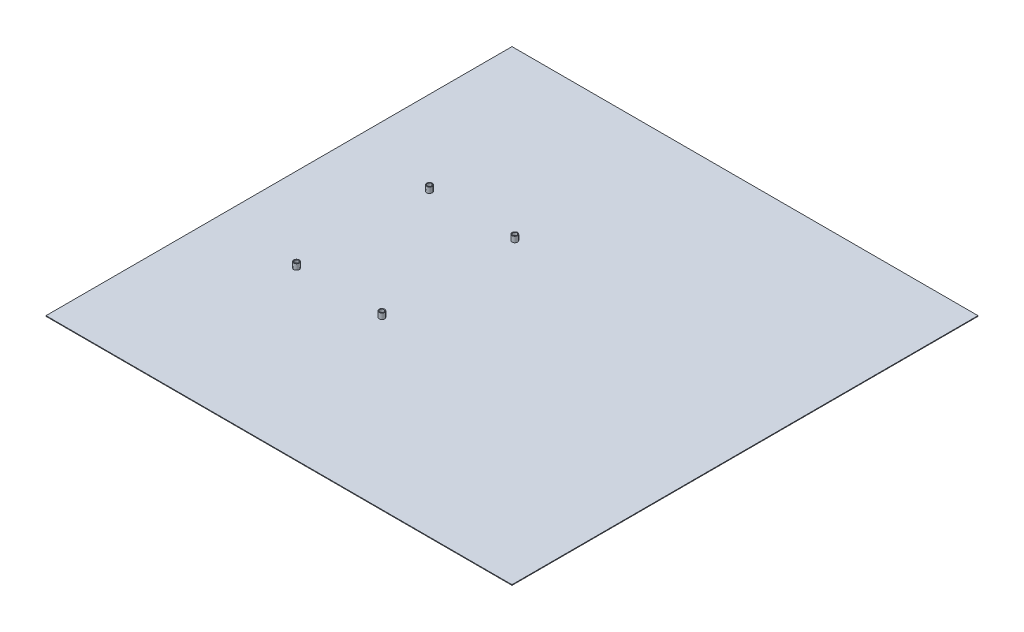
from build123d import *

# Parameters (mm, degrees)
SKETCH1_W           = 333
SKETCH1_H           = 333
BOSS_EXTRUDE1_DEPTH = 0.45
SKETCH2_R           = 2
SKETCH2_R_2         = 1.5
BOSS_EXTRUDE4_DEPTH = 4


with BuildPart() as part:
    # Sketch1 → Boss-Extrude1 (new body)
    with BuildSketch(Plane(origin=(0, 0, 0), x_dir=(1, 0, 0), z_dir=(0, 1, 0))):
        Rectangle(SKETCH1_W, SKETCH1_H)
    extrude(amount=BOSS_EXTRUDE1_DEPTH)

    # Sketch2 → Boss-Extrude4 (add)
    # profile 1 of 4: a face of its own
    with BuildSketch(Plane(origin=(0, 0.45, 0), x_dir=(1, 0, 0), z_dir=(0, 1, 0))):
        with Locations((-106.5, 47.5)):
            Circle(SKETCH2_R)
        with Locations((-106.5, 47.5)):
            Circle(SKETCH2_R_2, mode=Mode.SUBTRACT)
    # profile 2 of 4: a face of its own
    with BuildSketch(Plane(origin=(0, 0.45, 0), x_dir=(1, 0, 0), z_dir=(0, 1, 0))):
        with Locations((-45.5, 47.5)):
            Circle(SKETCH2_R)
        with Locations((-45.5, 47.5)):
            Circle(SKETCH2_R_2, mode=Mode.SUBTRACT)
    # profile 3 of 4: a face of its own
    with BuildSketch(Plane(origin=(0, 0.45, 0), x_dir=(1, 0, 0), z_dir=(0, 1, 0))):
        with Locations((-106.5, -47.5)):
            Circle(SKETCH2_R)
        with Locations((-106.5, -47.5)):
            Circle(SKETCH2_R_2, mode=Mode.SUBTRACT)
    # profile 4 of 4: a face of its own
    with BuildSketch(Plane(origin=(0, 0.45, 0), x_dir=(1, 0, 0), z_dir=(0, 1, 0))):
        with Locations((-45.5, -47.5)):
            Circle(SKETCH2_R)
        with Locations((-45.5, -47.5)):
            Circle(SKETCH2_R_2, mode=Mode.SUBTRACT)
    extrude(amount=BOSS_EXTRUDE4_DEPTH)


solid = part.part
